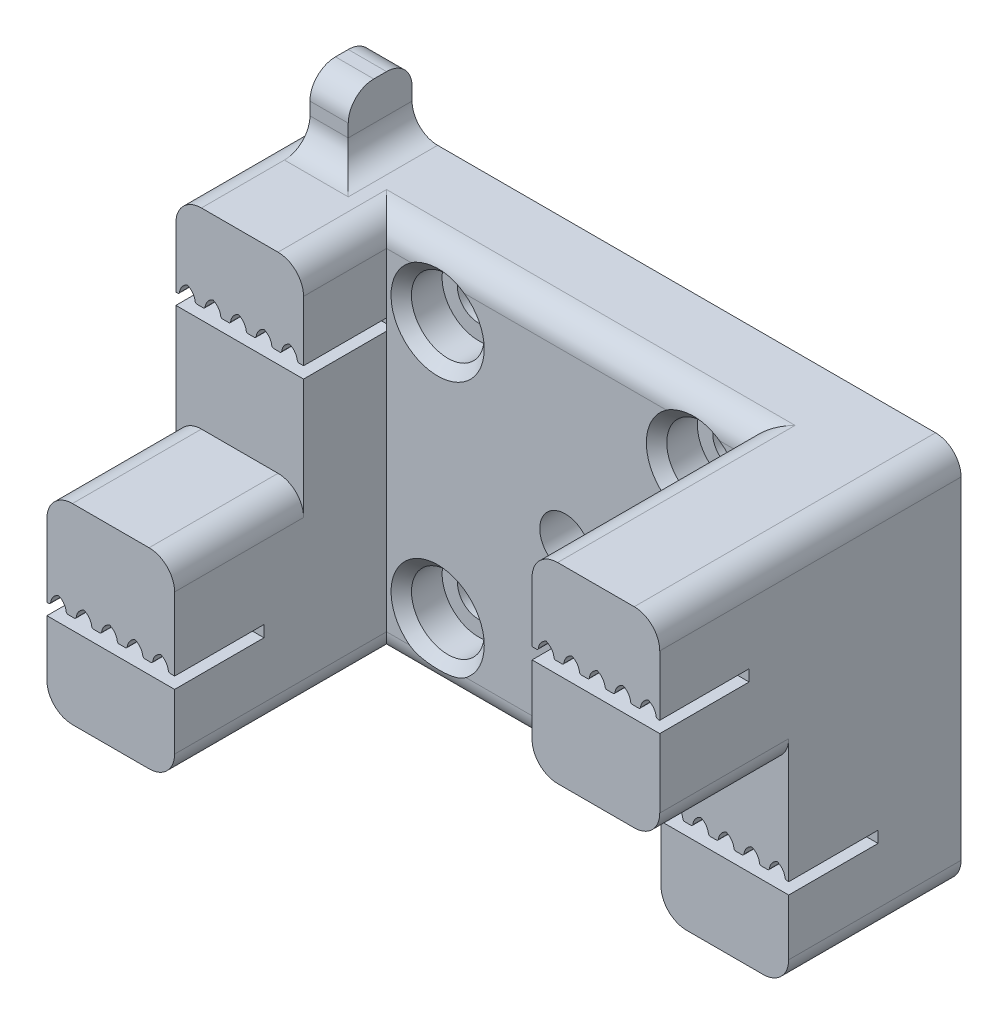
from build123d import *

# Parameters (mm, degrees)
SKETCH1_W              = 48
SKETCH1_H              = 30
SKETCH1_R              = 1.65
SKETCH1_R_2            = 2
BOSS_EXTRUDE1_DEPTH    = 7
SKETCH2_W              = 10
SKETCH2_H              = 15
BOSS_EXTRUDE2_DEPTH    = 16.6
SKETCH2_3_W            = 10
SKETCH2_3_H            = 15
BOSS_EXTRUDE3_DEPTH    = 6.5
SKETCH4_R              = 2.85
CUT_EXTRUDE1_DEPTH     = 3.2
SKETCH5_R              = 3.5
CUT_EXTRUDE2_DEPTH     = 3
CHAMFER1_SIZE          = 0.8
CUT_EXTRUDE3_START     = -7
CUT_EXTRUDE3_DEPTH     = 107
LPATTERN1_COUNT        = 2
LPATTERN1_PITCH        = 16
LPATTERN1_START        = -7
LPATTERN1_COPY_1_DEPTH = 107
SKETCH7_W              = 10
SKETCH7_H              = 2.5
BOSS_EXTRUDE4_DEPTH    = 10.1
FILLET1_R              = 2
SKETCH10_W             = 3
SKETCH10_H             = 5
BOSS_EXTRUDE7_DEPTH    = 5
FILLET3_R              = 2


with BuildPart() as part:
    # Sketch1 → Boss-Extrude1 (new body)
    with BuildSketch(Plane.XY):
        Rectangle(SKETCH1_W, SKETCH1_H)
        with Locations((-10, 10)):
            Circle(SKETCH1_R, mode=Mode.SUBTRACT)
        with Locations((10, 10)):
            Circle(SKETCH1_R, mode=Mode.SUBTRACT)
        with Locations((10, -10)):
            Circle(SKETCH1_R, mode=Mode.SUBTRACT)
        with Locations((-9.995165444, -10.096450463)):
            Circle(SKETCH1_R, mode=Mode.SUBTRACT)
        Circle(SKETCH1_R_2, mode=Mode.SUBTRACT)
    extrude(amount=BOSS_EXTRUDE1_DEPTH)

    # Sketch2 → Boss-Extrude2 (add)
    with BuildSketch(Plane.XY.offset(7)):
        with Locations((19, 7.5)):
            Rectangle(SKETCH2_W, SKETCH2_H)
        with Locations((-19, -7.5)):
            Rectangle(SKETCH2_W, SKETCH2_H)
    extrude(amount=BOSS_EXTRUDE2_DEPTH)

    # Sketch2<3> → Boss-Extrude3 (add)
    with BuildSketch(Plane.XY.offset(7)):
        with Locations((19, -7.5)):
            Rectangle(SKETCH2_3_W, SKETCH2_3_H)
        with Locations((-19, 7.5)):
            Rectangle(SKETCH2_3_W, SKETCH2_3_H)
    extrude(amount=BOSS_EXTRUDE3_DEPTH)

    # Sketch4 → Cut-Extrude1 (cut)
    with BuildSketch(Plane.XY.offset(7)):
        with Locations((-10, 10)):
            Circle(SKETCH4_R)
        with Locations((10, 10)):
            Circle(SKETCH4_R)
        with Locations((10, -10)):
            Circle(SKETCH4_R)
        with Locations((-9.995165444, -10.096450463)):
            Circle(SKETCH4_R)
    extrude(amount=-CUT_EXTRUDE1_DEPTH, mode=Mode.SUBTRACT)

    # Sketch5 → Cut-Extrude2 (cut)
    with BuildSketch(Plane(origin=(0, 0, 0), x_dir=(-1, 0, 0), z_dir=(0, 0, -1))):
        Circle(SKETCH5_R)
    extrude(amount=-CUT_EXTRUDE2_DEPTH, mode=Mode.SUBTRACT)

    # Chamfer1
    chamfer1_edges = [part.edges().sort_by_distance(p)[0] for p in [
        (-12.845165444, -10.096450463, 7),
        (7.15, -10, 7),
        (7.15, 10, 7),
        (-12.85, 10, 7),
        (3.5, 0, 0),
    ]]
    chamfer(chamfer1_edges, length=CHAMFER1_SIZE)

    # Sketch6 → Cut-Extrude3 (cut)
    with BuildSketch(Plane.XY.offset(13.5).offset(CUT_EXTRUDE3_START)):
        with BuildLine():
            Line((-16.343030427, 8.292790594), (-15.861475771, 8.292790594))
            ThreePointArc((-15.861475771, 8.292790594), (-15.7625687, 8.330019182), (-15.712757238, 8.423225377))
            ThreePointArc((-15.712757238, 8.423225377), (-15.514111468, 8.902258005), (-15.102253099, 9.2173851))
            ThreePointArc((-15.102253099, 9.2173851), (-14.690394731, 8.902258005), (-14.491748961, 8.423225377))
            ThreePointArc((-14.491748961, 8.423225377), (-14.441937498, 8.330019182), (-14.343030427, 8.292790594))
            Line((-14.343030427, 8.292790594), (-14, 8.292790594))
            Line((-14, 8.292790594), (-14, 7.392790594))
            Line((-14, 7.392790594), (-24, 7.392790594))
            Line((-24, 7.392790594), (-24, 8.292790594))
            Line((-24, 8.292790594), (-23.997274496, 8.292790594))
            Line((-23.997274496, 8.292790594), (-23.861475771, 8.292790594))
            ThreePointArc((-23.861475771, 8.292790594), (-23.7625687, 8.330019182), (-23.712757238, 8.423225377))
            ThreePointArc((-23.712757238, 8.423225377), (-23.514111468, 8.902258005), (-23.102253099, 9.2173851))
            ThreePointArc((-23.102253099, 9.2173851), (-22.690394731, 8.902258005), (-22.491748961, 8.423225377))
            ThreePointArc((-22.491748961, 8.423225377), (-22.441937498, 8.330019182), (-22.343030427, 8.292790594))
            Line((-22.343030427, 8.292790594), (-21.861475771, 8.292790594))
            ThreePointArc((-21.861475771, 8.292790594), (-21.7625687, 8.330019182), (-21.712757238, 8.423225377))
            ThreePointArc((-21.712757238, 8.423225377), (-21.514111468, 8.902258005), (-21.102253099, 9.2173851))
            ThreePointArc((-21.102253099, 9.2173851), (-20.690394731, 8.902258005), (-20.491748961, 8.423225377))
            ThreePointArc((-20.491748961, 8.423225377), (-20.441937498, 8.330019182), (-20.343030427, 8.292790594))
            Line((-20.343030427, 8.292790594), (-19.861475771, 8.292790594))
            ThreePointArc((-19.861475771, 8.292790594), (-19.7625687, 8.330019182), (-19.712757238, 8.423225377))
            ThreePointArc((-19.712757238, 8.423225377), (-19.514111468, 8.902258005), (-19.102253099, 9.2173851))
            ThreePointArc((-19.102253099, 9.2173851), (-18.690394731, 8.902258005), (-18.491748961, 8.423225377))
            ThreePointArc((-18.491748961, 8.423225377), (-18.441937498, 8.330019182), (-18.343030427, 8.292790594))
            Line((-18.343030427, 8.292790594), (-17.861475771, 8.292790594))
            ThreePointArc((-17.861475771, 8.292790594), (-17.7625687, 8.330019182), (-17.712757238, 8.423225377))
            ThreePointArc((-17.712757238, 8.423225377), (-17.514111468, 8.902258005), (-17.102253099, 9.2173851))
            ThreePointArc((-17.102253099, 9.2173851), (-16.690394731, 8.902258005), (-16.491748961, 8.423225377))
            ThreePointArc((-16.491748961, 8.423225377), (-16.441937498, 8.330019182), (-16.343030427, 8.292790594))
        make_face()
    cut_extrude3 = extrude(amount=CUT_EXTRUDE3_DEPTH, mode=Mode.SUBTRACT)

    # Mirror3: Cut-Extrude3 across plane
    add(cut_extrude3.mirror(Plane(origin=(0, 0, 0), x_dir=(0, 0, 1), z_dir=(1, 0, 0))), mode=Mode.SUBTRACT)

    # LPattern1: Cut-Extrude3 ×2
    with Locations(*[(0, -i * LPATTERN1_PITCH, 0) for i in range(1, LPATTERN1_COUNT)]):
        add(cut_extrude3, mode=Mode.SUBTRACT)

    # LPattern1 copy 1 sketch → LPattern1 copy 1 (cut)
    with BuildSketch(Plane(origin=(0, -16, 13.5), x_dir=(-1, 0, 0), z_dir=(0, 0, 1)).offset(LPATTERN1_START)):
        with BuildLine():
            Line((-16.343030427, -8.292790594), (-15.861475771, -8.292790594))
            ThreePointArc((-15.861475771, -8.292790594), (-15.7625687, -8.330019182), (-15.712757238, -8.423225377))
            ThreePointArc((-15.712757238, -8.423225377), (-15.514111468, -8.902258005), (-15.102253099, -9.2173851))
            ThreePointArc((-15.102253099, -9.2173851), (-14.690394731, -8.902258005), (-14.491748961, -8.423225377))
            ThreePointArc((-14.491748961, -8.423225377), (-14.441937498, -8.330019182), (-14.343030427, -8.292790594))
            Line((-14.343030427, -8.292790594), (-14, -8.292790594))
            Line((-14, -8.292790594), (-14, -7.392790594))
            Line((-14, -7.392790594), (-24, -7.392790594))
            Line((-24, -7.392790594), (-24, -8.292790594))
            Line((-24, -8.292790594), (-23.997274496, -8.292790594))
            Line((-23.997274496, -8.292790594), (-23.861475771, -8.292790594))
            ThreePointArc((-23.861475771, -8.292790594), (-23.7625687, -8.330019182), (-23.712757238, -8.423225377))
            ThreePointArc((-23.712757238, -8.423225377), (-23.514111468, -8.902258005), (-23.102253099, -9.2173851))
            ThreePointArc((-23.102253099, -9.2173851), (-22.690394731, -8.902258005), (-22.491748961, -8.423225377))
            ThreePointArc((-22.491748961, -8.423225377), (-22.441937498, -8.330019182), (-22.343030427, -8.292790594))
            Line((-22.343030427, -8.292790594), (-21.861475771, -8.292790594))
            ThreePointArc((-21.861475771, -8.292790594), (-21.7625687, -8.330019182), (-21.712757238, -8.423225377))
            ThreePointArc((-21.712757238, -8.423225377), (-21.514111468, -8.902258005), (-21.102253099, -9.2173851))
            ThreePointArc((-21.102253099, -9.2173851), (-20.690394731, -8.902258005), (-20.491748961, -8.423225377))
            ThreePointArc((-20.491748961, -8.423225377), (-20.441937498, -8.330019182), (-20.343030427, -8.292790594))
            Line((-20.343030427, -8.292790594), (-19.861475771, -8.292790594))
            ThreePointArc((-19.861475771, -8.292790594), (-19.7625687, -8.330019182), (-19.712757238, -8.423225377))
            ThreePointArc((-19.712757238, -8.423225377), (-19.514111468, -8.902258005), (-19.102253099, -9.2173851))
            ThreePointArc((-19.102253099, -9.2173851), (-18.690394731, -8.902258005), (-18.491748961, -8.423225377))
            ThreePointArc((-18.491748961, -8.423225377), (-18.441937498, -8.330019182), (-18.343030427, -8.292790594))
            Line((-18.343030427, -8.292790594), (-17.861475771, -8.292790594))
            ThreePointArc((-17.861475771, -8.292790594), (-17.7625687, -8.330019182), (-17.712757238, -8.423225377))
            ThreePointArc((-17.712757238, -8.423225377), (-17.514111468, -8.902258005), (-17.102253099, -9.2173851))
            ThreePointArc((-17.102253099, -9.2173851), (-16.690394731, -8.902258005), (-16.491748961, -8.423225377))
            ThreePointArc((-16.491748961, -8.423225377), (-16.441937498, -8.330019182), (-16.343030427, -8.292790594))
        make_face()
    extrude(amount=LPATTERN1_COPY_1_DEPTH, mode=Mode.SUBTRACT)

    # Sketch7 → Boss-Extrude4 (add)
    with BuildSketch(Plane.XY.offset(6.5)):
        with Locations((-19, -7.357209406)):
            Rectangle(SKETCH7_W, SKETCH7_H)
        with BuildLine():
            Line((14, 8.292790594), (14, 7.392790594))
            Line((14, 7.392790594), (24, 7.392790594))
            Line((24, 7.392790594), (24, 8.292790594))
            Line((24, 8.292790594), (23.861475771, 8.292790594))
            ThreePointArc((23.861475771, 8.292790594), (23.7625687, 8.330019182), (23.712757238, 8.423225377))
            ThreePointArc((23.712757238, 8.423225377), (23.514111468, 8.902258005), (23.102253099, 9.2173851))
            ThreePointArc((23.102253099, 9.2173851), (22.690394731, 8.902258005), (22.491748961, 8.423225377))
            ThreePointArc((22.491748961, 8.423225377), (22.441937498, 8.330019182), (22.343030427, 8.292790594))
            Line((22.343030427, 8.292790594), (21.861475771, 8.292790594))
            ThreePointArc((21.861475771, 8.292790594), (21.7625687, 8.330019182), (21.712757238, 8.423225377))
            ThreePointArc((21.712757238, 8.423225377), (21.514111468, 8.902258005), (21.102253099, 9.2173851))
            ThreePointArc((21.102253099, 9.2173851), (20.690394731, 8.902258005), (20.491748961, 8.423225377))
            ThreePointArc((20.491748961, 8.423225377), (20.441937498, 8.330019182), (20.343030427, 8.292790594))
            Line((20.343030427, 8.292790594), (19.861475771, 8.292790594))
            ThreePointArc((19.861475771, 8.292790594), (19.7625687, 8.330019182), (19.712757238, 8.423225377))
            ThreePointArc((19.712757238, 8.423225377), (19.514111468, 8.902258005), (19.102253099, 9.2173851))
            ThreePointArc((19.102253099, 9.2173851), (18.690394731, 8.902258005), (18.491748961, 8.423225377))
            ThreePointArc((18.491748961, 8.423225377), (18.441937498, 8.330019182), (18.343030427, 8.292790594))
            Line((18.343030427, 8.292790594), (17.861475771, 8.292790594))
            ThreePointArc((17.861475771, 8.292790594), (17.7625687, 8.330019182), (17.712757238, 8.423225377))
            ThreePointArc((17.712757238, 8.423225377), (17.514111468, 8.902258005), (17.102253099, 9.2173851))
            ThreePointArc((17.102253099, 9.2173851), (16.690394731, 8.902258005), (16.491748961, 8.423225377))
            ThreePointArc((16.491748961, 8.423225377), (16.441937498, 8.330019182), (16.343030427, 8.292790594))
            Line((16.343030427, 8.292790594), (15.861475771, 8.292790594))
            ThreePointArc((15.861475771, 8.292790594), (15.7625687, 8.330019182), (15.712757238, 8.423225377))
            ThreePointArc((15.712757238, 8.423225377), (15.514111468, 8.902258005), (15.102253099, 9.2173851))
            ThreePointArc((15.102253099, 9.2173851), (14.690394731, 8.902258005), (14.491748961, 8.423225377))
            ThreePointArc((14.491748961, 8.423225377), (14.441937498, 8.330019182), (14.343030427, 8.292790594))
            Line((14.343030427, 8.292790594), (14, 8.292790594))
        make_face()
    extrude(amount=BOSS_EXTRUDE4_DEPTH)

    # Fillet1
    # the kernel refuses this fillet: 2 mm, written as the material it takes off along each edge
    with BuildSketch(Plane(origin=(14, 15, 7), x_dir=(0, -1, 0), z_dir=(-1, 0, 0)), Plane(origin=(-14, -15, 7), x_dir=(0, 1, 0), z_dir=(1, 0, 0))) as fillet1_piece_1:
        with BuildLine():
            CenterArc((FILLET1_R, -FILLET1_R), FILLET1_R, 90, 90)
            Line((0, -FILLET1_R), (0, 0))
            Line((0, 0), (FILLET1_R, 0))
        make_face()
    extrude(amount=28, mode=Mode.SUBTRACT)
    with BuildSketch(Plane(origin=(14, 15, 7), x_dir=(1, 0, 0), z_dir=(0, 0, 1)), Plane(origin=(-14, -15, 7), x_dir=(-1, 0, 0), z_dir=(0, 0, 1))) as fillet1_piece_2:
        with BuildLine():
            CenterArc((FILLET1_R, -FILLET1_R), FILLET1_R, 90, 90)
            Line((0, -FILLET1_R), (0, 0))
            Line((0, 0), (FILLET1_R, 0))
        make_face()
    extrude(amount=21.6, mode=Mode.SUBTRACT)
    with BuildSketch(Plane(origin=(14, 0, 13.5), x_dir=(1, 0, 0), z_dir=(0, 0, 1)), Plane(origin=(24, 0, 13.5), x_dir=(0, 1, 0), z_dir=(0, 0, 1)), Plane(origin=(-14, 0, 13.5), x_dir=(-1, 0, 0), z_dir=(0, 0, 1)), Plane(origin=(-24, 0, 13.5), x_dir=(0, -1, 0), z_dir=(0, 0, 1))) as fillet1_piece_3:
        with BuildLine():
            CenterArc((FILLET1_R, FILLET1_R), FILLET1_R, 180, 90)
            Line((0, FILLET1_R), (0, 0))
            Line((0, 0), (FILLET1_R, 0))
        make_face()
    extrude(amount=15.1, mode=Mode.SUBTRACT)
    with BuildSketch(Plane(origin=(14, -15, 7), x_dir=(0, 1, 0), z_dir=(0, 0, 1)), Plane(origin=(-14, 15, 7), x_dir=(0, -1, 0), z_dir=(0, 0, 1))) as fillet1_piece_4:
        with BuildLine():
            CenterArc((FILLET1_R, -FILLET1_R), FILLET1_R, 90, 90)
            Line((0, -FILLET1_R), (0, 0))
            Line((0, 0), (FILLET1_R, 0))
        make_face()
    extrude(amount=11.5, mode=Mode.SUBTRACT)
    with BuildSketch(Plane(origin=(24, -15, -5), x_dir=(0, 1, 0), z_dir=(0, 0, 1))) as fillet1_piece_5:
        with BuildLine():
            CenterArc((FILLET1_R, FILLET1_R), FILLET1_R, 180, 90)
            Line((0, FILLET1_R), (0, 0))
            Line((0, 0), (FILLET1_R, 0))
        make_face()
    extrude(amount=23.5, mode=Mode.SUBTRACT)
    with BuildSketch(Plane(origin=(-24, -15, 28.6), x_dir=(0, 1, 0), z_dir=(0, 0, -1))) as fillet1_piece_6:
        with BuildLine():
            CenterArc((FILLET1_R, FILLET1_R), FILLET1_R, 180, 90)
            Line((0, FILLET1_R), (0, 0))
            Line((0, 0), (FILLET1_R, 0))
        make_face()
    extrude(amount=33.6, mode=Mode.SUBTRACT)
    with BuildSketch(Plane(origin=(-24, 15, 18.5), x_dir=(0, -1, 0), z_dir=(0, 0, -1))) as fillet1_piece_7:
        with BuildLine():
            CenterArc((FILLET1_R, -FILLET1_R), FILLET1_R, 90, 90)
            Line((0, -FILLET1_R), (0, 0))
            Line((0, 0), (FILLET1_R, 0))
        make_face()
    extrude(amount=23.5, mode=Mode.SUBTRACT)
    with BuildSketch(Plane(origin=(24, 15, -5), x_dir=(0, -1, 0), z_dir=(0, 0, 1))) as fillet1_piece_8:
        with BuildLine():
            CenterArc((FILLET1_R, -FILLET1_R), FILLET1_R, 90, 90)
            Line((0, -FILLET1_R), (0, 0))
            Line((0, 0), (FILLET1_R, 0))
        make_face()
    extrude(amount=33.6, mode=Mode.SUBTRACT)
    with BuildSketch(Plane(origin=(19, 15, 7), x_dir=(0, -1, 0), z_dir=(-1, 0, 0))) as fillet1_piece_9a_section:
        with BuildLine():
            CenterArc((FILLET1_R, -FILLET1_R), FILLET1_R, 90, 90)
            Line((0, -FILLET1_R), (0, 0))
            Line((0, 0), (FILLET1_R, 0))
        make_face()
    fillet1_piece_9a = extrude(amount=33, mode=Mode.PRIVATE)
    fillet1_piece_9a = split(fillet1_piece_9a, bisect_by=Plane(origin=(14, 14.547209771, 6.547209771), z_dir=(1, 0, 0)), keep=Keep.TOP, mode=Mode.PRIVATE)
    with BuildSketch(Plane(origin=(14, 15, 2), x_dir=(1, 0, 0), z_dir=(0, 0, 1))) as fillet1_piece_9b_section:
        with BuildLine():
            CenterArc((FILLET1_R, -FILLET1_R), FILLET1_R, 90, 90)
            Line((0, -FILLET1_R), (0, 0))
            Line((0, 0), (FILLET1_R, 0))
        make_face()
    fillet1_piece_9b = extrude(amount=26.6, mode=Mode.PRIVATE)
    fillet1_piece_9b = split(fillet1_piece_9b, bisect_by=Plane(origin=(14.452790229, 14.547209771, 7), z_dir=(0, 0, -1)), keep=Keep.TOP, mode=Mode.PRIVATE)
    fillet1_piece_9 = fillet1_piece_9a & fillet1_piece_9b
    add(fillet1_piece_9, mode=Mode.SUBTRACT)
    with BuildSketch(Plane(origin=(14, 15, 7), x_dir=(0, -1, 0), z_dir=(-1, 0, 0))) as fillet1_piece_10a_section:
        with BuildLine():
            CenterArc((FILLET1_R, -FILLET1_R), FILLET1_R, 90, 90)
            Line((0, -FILLET1_R), (0, 0))
            Line((0, 0), (FILLET1_R, 0))
        make_face()
    fillet1_piece_10a = extrude(amount=33, mode=Mode.PRIVATE)
    fillet1_piece_10a = split(fillet1_piece_10a, bisect_by=Plane(origin=(-14, 14.547209771, 6.547209771), z_dir=(-1, 0, 0)), keep=Keep.TOP, mode=Mode.PRIVATE)
    with BuildSketch(Plane(origin=(-14, 15, 2), x_dir=(0, -1, 0), z_dir=(0, 0, 1))) as fillet1_piece_10b_section:
        with BuildLine():
            CenterArc((FILLET1_R, -FILLET1_R), FILLET1_R, 90, 90)
            Line((0, -FILLET1_R), (0, 0))
            Line((0, 0), (FILLET1_R, 0))
        make_face()
    fillet1_piece_10b = extrude(amount=16.5, mode=Mode.PRIVATE)
    fillet1_piece_10b = split(fillet1_piece_10b, bisect_by=Plane(origin=(-14.452790229, 14.547209771, 7), z_dir=(0, 0, -1)), keep=Keep.TOP, mode=Mode.PRIVATE)
    fillet1_piece_10 = fillet1_piece_10a & fillet1_piece_10b
    add(fillet1_piece_10, mode=Mode.SUBTRACT)
    with BuildSketch(Plane(origin=(-19, -15, 7), x_dir=(0, 1, 0), z_dir=(1, 0, 0))) as fillet1_piece_11a_section:
        with BuildLine():
            CenterArc((FILLET1_R, -FILLET1_R), FILLET1_R, 90, 90)
            Line((0, -FILLET1_R), (0, 0))
            Line((0, 0), (FILLET1_R, 0))
        make_face()
    fillet1_piece_11a = extrude(amount=33, mode=Mode.PRIVATE)
    fillet1_piece_11a = split(fillet1_piece_11a, bisect_by=Plane(origin=(-14, -14.547209771, 6.547209771), z_dir=(-1, 0, 0)), keep=Keep.TOP, mode=Mode.PRIVATE)
    with BuildSketch(Plane(origin=(-14, -15, 2), x_dir=(-1, 0, 0), z_dir=(0, 0, 1))) as fillet1_piece_11b_section:
        with BuildLine():
            CenterArc((FILLET1_R, -FILLET1_R), FILLET1_R, 90, 90)
            Line((0, -FILLET1_R), (0, 0))
            Line((0, 0), (FILLET1_R, 0))
        make_face()
    fillet1_piece_11b = extrude(amount=26.6, mode=Mode.PRIVATE)
    fillet1_piece_11b = split(fillet1_piece_11b, bisect_by=Plane(origin=(-14.452790229, -14.547209771, 7), z_dir=(0, 0, -1)), keep=Keep.TOP, mode=Mode.PRIVATE)
    fillet1_piece_11 = fillet1_piece_11a & fillet1_piece_11b
    add(fillet1_piece_11, mode=Mode.SUBTRACT)
    with BuildSketch(Plane(origin=(-14, -15, 7), x_dir=(0, 1, 0), z_dir=(1, 0, 0))) as fillet1_piece_12a_section:
        with BuildLine():
            CenterArc((FILLET1_R, -FILLET1_R), FILLET1_R, 90, 90)
            Line((0, -FILLET1_R), (0, 0))
            Line((0, 0), (FILLET1_R, 0))
        make_face()
    fillet1_piece_12a = extrude(amount=33, mode=Mode.PRIVATE)
    fillet1_piece_12a = split(fillet1_piece_12a, bisect_by=Plane(origin=(14, -14.547209771, 6.547209771), z_dir=(1, 0, 0)), keep=Keep.TOP, mode=Mode.PRIVATE)
    with BuildSketch(Plane(origin=(14, -15, 2), x_dir=(0, 1, 0), z_dir=(0, 0, 1))) as fillet1_piece_12b_section:
        with BuildLine():
            CenterArc((FILLET1_R, -FILLET1_R), FILLET1_R, 90, 90)
            Line((0, -FILLET1_R), (0, 0))
            Line((0, 0), (FILLET1_R, 0))
        make_face()
    fillet1_piece_12b = extrude(amount=16.5, mode=Mode.PRIVATE)
    fillet1_piece_12b = split(fillet1_piece_12b, bisect_by=Plane(origin=(14.452790229, -14.547209771, 7), z_dir=(0, 0, -1)), keep=Keep.TOP, mode=Mode.PRIVATE)
    fillet1_piece_12 = fillet1_piece_12a & fillet1_piece_12b
    add(fillet1_piece_12, mode=Mode.SUBTRACT)

    # Sketch10 → Boss-Extrude7 (add)
    with BuildSketch(Plane(origin=(0, 15, 0), x_dir=(1, 0, 0), z_dir=(0, 1, 0))):
        with Locations((-20.5, -2.5)):
            Rectangle(SKETCH10_W, SKETCH10_H)
    extrude(amount=BOSS_EXTRUDE7_DEPTH)

    # Fillet3
    fillet3_edges = [part.edges().sort_by_distance(p)[0] for p in [
        (-20.5, 15, 5),
        (-19, 15, 2.5),
        (-20.5, 20, 5),
        (-20.5, 20, 0),
    ]]
    fillet(fillet3_edges, radius=FILLET3_R)


solid = part.part
